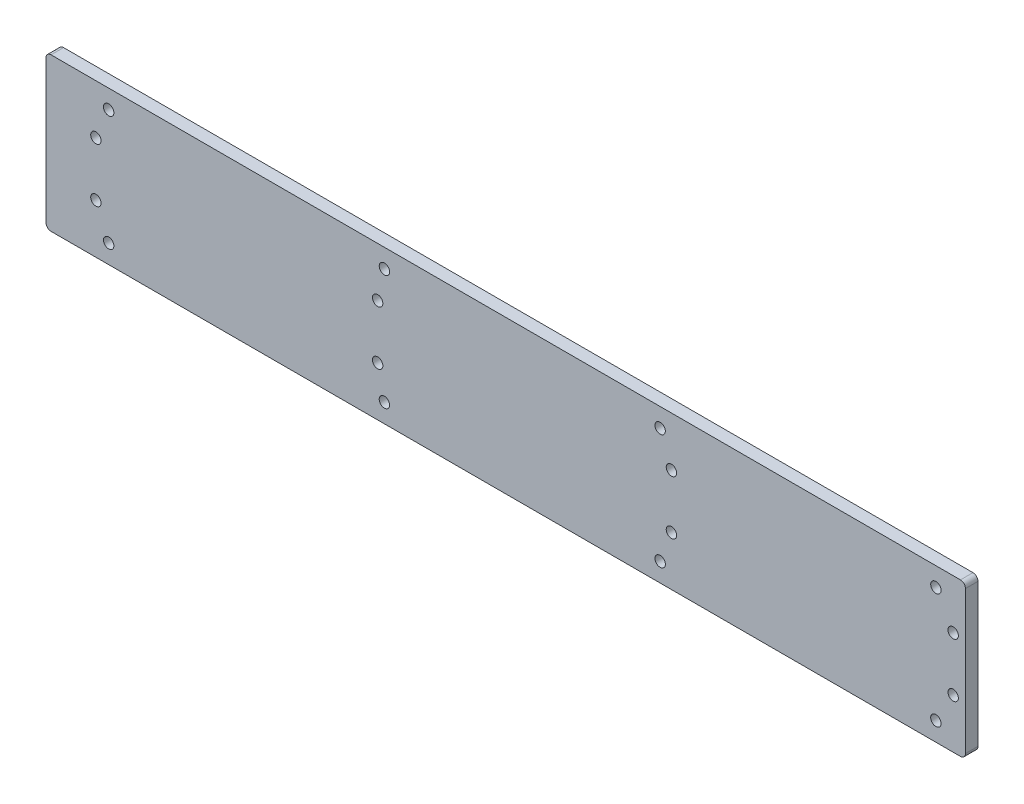
from build123d import *

# Parameters (mm, degrees)
SALIENTE_EXTRUIR1_DEPTH = 6.35
CROQUIS4_R              = 2.63125
CORTAR_EXTRUIR2_DEPTH   = 246.599940908
CROQUIS5_R              = 2.63125
CORTAR_EXTRUIR3_DEPTH   = 246.599940908
REDONDEO1_R             = 2.54


with BuildPart() as part:
    # Croquis2 → Saliente-Extruir1 (new body)
    with BuildSketch(Plane.XY):
        Polygon((-242.443, -38.735), (-242.443, 38.735), (223.393, 38.735), (223.393, 19.685), (223.393, -19.685), (223.393, -38.735), align=None)
    extrude(amount=SALIENTE_EXTRUIR1_DEPTH)

    # Croquis4 → Cortar-Extruir2 (cut, through all)
    with BuildSketch(Plane.XY.offset(6.35)):
        with Locations((-217.17, 13.68025)):
            Circle(CROQUIS4_R)
        with Locations((-217.17, -13.68025)):
            Circle(CROQUIS4_R)
        with Locations((217.17, -13.68025)):
            Circle(CROQUIS4_R)
        with Locations((217.17, 13.68025)):
            Circle(CROQUIS4_R)
        with Locations((-74.422, 13.68025)):
            Circle(CROQUIS4_R)
        with Locations((-74.422, -13.68025)):
            Circle(CROQUIS4_R)
        with Locations((74.422, 13.68025)):
            Circle(CROQUIS4_R)
        with Locations((74.422, -13.68025)):
            Circle(CROQUIS4_R)
    extrude(amount=-CORTAR_EXTRUIR2_DEPTH, mode=Mode.SUBTRACT)

    # Croquis5 → Cortar-Extruir3 (cut, through all)
    with BuildSketch(Plane.XY.offset(6.35)):
        with Locations((-210.693, 29.21)):
            Circle(CROQUIS5_R)
        with Locations((-70.993, 29.21)):
            Circle(CROQUIS5_R)
        with Locations((68.707, 29.21)):
            Circle(CROQUIS5_R)
        with Locations((208.407, 29.21)):
            Circle(CROQUIS5_R)
        with Locations((208.407, -29.21)):
            Circle(CROQUIS5_R)
        with Locations((68.707, -29.21)):
            Circle(CROQUIS5_R)
        with Locations((-70.993, -29.21)):
            Circle(CROQUIS5_R)
        with Locations((-210.693, -29.21)):
            Circle(CROQUIS5_R)
    extrude(amount=-CORTAR_EXTRUIR3_DEPTH, mode=Mode.SUBTRACT)

    # Redondeo1
    redondeo1_edges = [part.edges().sort_by_distance(p)[0] for p in [
        (223.393, -38.735, 3.175),
        (223.393, 38.735, 3.175),
        (-242.443, -38.735, 3.175),
        (-242.443, 38.735, 3.175),
    ]]
    fillet(redondeo1_edges, radius=REDONDEO1_R)


solid = part.part
